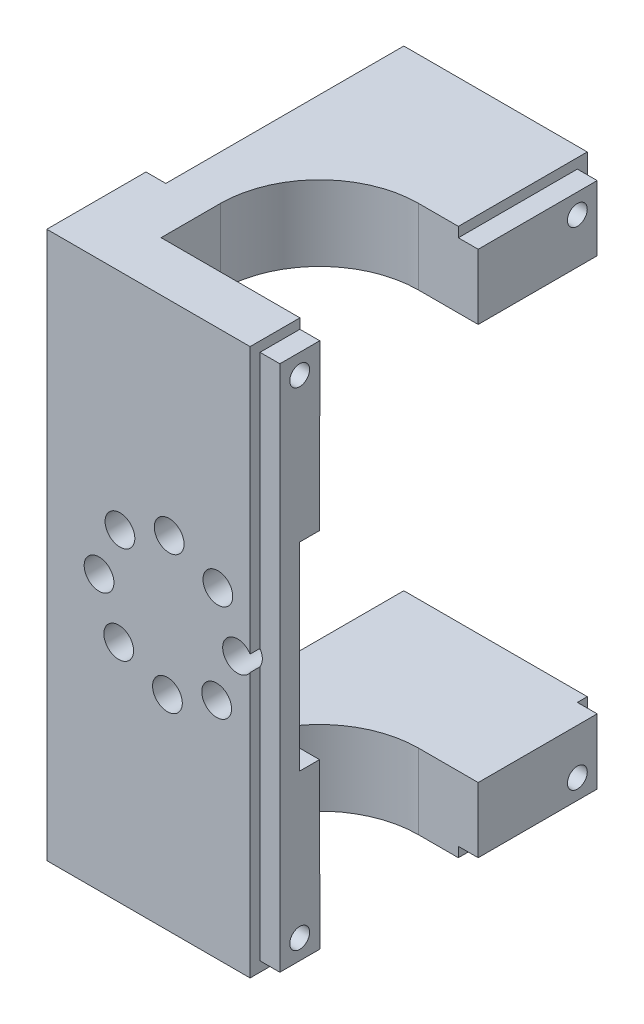
from build123d import *

# Parameters (mm, degrees)
SKETCH_1_W           = 20.5
SKETCH_1_H           = 15.141704846
SKETCH_1_R           = 2
EXTRUDE_1_DEPTH      = 29
EXTRUDE_1_2_DEPTH    = 29
SKETCH_2_W           = 20.5
SKETCH_2_H           = 70.283409692
EXTRUDE_2_DEPTH      = 3
SKETCH_3_W           = 20.5
SKETCH_3_H           = 7.570852423
CUT_EXTRUDE_1_DEPTH  = 49.621002864
EXTRUDE_3_DEPTH      = 10
CUT_EXTRUDE_2_REACH  = 75.297
SKETCH_8_R           = 1.6
SKETCH_9_W           = 20.5
SKETCH_9_H           = 32
CUT_EXTRUDE_3_DEPTH  = 65.572982844
SKETCH_12_W          = 20.5
SKETCH_12_H          = 7.570852423
SKETCH_12_R          = 2
EXTRUDE_5_DEPTH      = 30
SKETCH_13_R          = 4
SKETCH_13_R_2        = 2.5
EXTRUDE_6_DEPTH      = 10
CUT_EXTRUDE_5_DEPTH  = 48.388093988
CUT_EXTRUDE_6_DEPTH  = 51.404676959
EXTRUDE_START        = 10
EXTRUDE_7_DEPTH      = 10
CUT_EXTRUDE_7_DEPTH  = 48.388094067
CUT_EXTRUDE_8_DEPTH  = 51.404676959
SKETCH_23_W          = 20.5
SKETCH_23_H          = 55.141704846
EXTRUDE_8_DEPTH      = 2
SKETCH_24_W          = 10
SKETCH_24_H          = 55.141704846
EXTRUDE_9_DEPTH      = 2
SKETCH_25_W          = 8
SKETCH_25_H          = 7.570852423
CUT_EXTRUDE_9_DEPTH  = 16
EXTRUDE_START_2      = 20
SKETCH_26_R          = 2
EXTRUDE_10_DEPTH     = 20
SKETCH_27_W          = 16
SKETCH_27_H          = 8
CUT_EXTRUDE_10_DEPTH = 75.494994619
SKETCH_29_W          = 34
SKETCH_29_H          = 55.141704846
SKETCH_29_W_2        = 32
SKETCH_29_H_2        = 53.141704846
CUT_EXTRUDE_11_DEPTH = 2
SKETCH_32_W          = 15.976862795
SKETCH_32_H          = 55.18580585
CUT_EXTRUDE_13_DEPTH = 16
SKETCH_33_R          = 1
CUT_EXTRUDE_14_DEPTH = 16
SKETCH_35_R          = 1
CUT_EXTRUDE_15_DEPTH = 5
SKETCH_36_R          = 2.65
CUT_EXTRUDE_16_DEPTH = 10
CUT_EXTRUDE_START    = -10
SKETCH_37_R          = 2.65
CUT_EXTRUDE_17_DEPTH = 10
SKETCH_38_W          = 122.701486855
SKETCH_38_H          = 146.920996025
SKETCH_38_W_2        = 22.5
SKETCH_38_H_2        = 55.141704846
CUT_EXTRUDE_18_DEPTH = 50.016644776
SKETCH_39_R          = 1.5
CUT_EXTRUDE_22_DEPTH = 5
SKETCH_41_W          = 20.5
SKETCH_41_H          = 20
CUT_EXTRUDE_23_DEPTH = 2
FILLET_1_R           = 10
FILLET_2_R           = 10


with BuildPart() as part:
    # 草图1 → 凸台-拉伸1 (new body)
    with BuildSketch(Plane.XY):
        with Locations((0, -27.570852423)):
            Rectangle(SKETCH_1_W, SKETCH_1_H)
        with Locations((-5, -25)):
            Circle(SKETCH_1_R, mode=Mode.SUBTRACT)
        with Locations((5, -25)):
            Circle(SKETCH_1_R, mode=Mode.SUBTRACT)
    extrude(amount=EXTRUDE_1_DEPTH)



with BuildPart() as body_2:
    # 草图1 → Extrude 1 2 (new body)
    with BuildSketch(Plane.XY):
        with Locations((0, 27.570852423)):
            Rectangle(SKETCH_1_W, SKETCH_1_H)
        with Locations((5, 25)):
            Circle(SKETCH_1_R, mode=Mode.SUBTRACT)
        with Locations((-5, 25)):
            Circle(SKETCH_1_R, mode=Mode.SUBTRACT)
    extrude(amount=EXTRUDE_1_2_DEPTH)


with BuildPart() as part_1:
    add(part.part)

    add(body_2.part)  # 凸台-拉伸2 merges body 2
    # 草图2 → 凸台-拉伸2 (add)
    with BuildSketch(Plane.XY.offset(29)):
        Rectangle(SKETCH_2_W, SKETCH_2_H)
    extrude(amount=EXTRUDE_2_DEPTH)

    # 草图3 → 切除-拉伸1 (cut, through all)
    with BuildSketch(Plane(origin=(0, 0, 0), x_dir=(-1, 0, 0), z_dir=(0, 0, -1))):
        with Locations((0, -31.356278635)):
            Rectangle(SKETCH_3_W, SKETCH_3_H)
        with Locations((0, 31.356278635)):
            Rectangle(SKETCH_3_W, SKETCH_3_H)
    extrude(amount=-CUT_EXTRUDE_1_DEPTH, mode=Mode.SUBTRACT)

    # 草图5 → 凸台-拉伸3 (add)
    with BuildSketch(Plane.XZ.offset(27.570852423)):
        with BuildLine():
            ThreePointArc((0, 0), (1.767766953, 0.732233047), (2.5, 2.5))
            ThreePointArc((2.5, 2.5), (-1.767766953, 4.267766953), (0, 0))
        make_face()
    extrude(amount=EXTRUDE_3_DEPTH)

    # 草图8 → 切除-拉伸2 (cut, up to next)
    with BuildSketch(Plane(origin=(0, 27.570852423, 0), x_dir=(1, 0, 0), z_dir=(0, 1, 0)), mode=Mode.PRIVATE) as cut_extrude_2_sk1:
        with Locations((0, -16.5)):
            Circle(SKETCH_8_R)
    cut_extrude_2_tool1 = extrude(cut_extrude_2_sk1.sketch, amount=-CUT_EXTRUDE_2_REACH, mode=Mode.PRIVATE) & part_1.part
    # 草图8 → 切除-拉伸2 (cut, up to next)
    with BuildSketch(Plane(origin=(0, 27.570852423, 0), x_dir=(1, 0, 0), z_dir=(0, 1, 0)), mode=Mode.PRIVATE) as cut_extrude_2_sk2:
        with Locations((0, -26.5)):
            Circle(SKETCH_8_R)
    cut_extrude_2_tool2 = extrude(cut_extrude_2_sk2.sketch, amount=-CUT_EXTRUDE_2_REACH, mode=Mode.PRIVATE) & part_1.part
    add(cut_extrude_2_tool1.solids().sort_by_distance((0, 27.570852, 16.5))[0], mode=Mode.SUBTRACT)
    add(cut_extrude_2_tool2.solids().sort_by_distance((0, 27.570852, 26.5))[0], mode=Mode.SUBTRACT)

    # 草图9 → 切除-拉伸3 (cut, through all)
    with BuildSketch(Plane.XZ.offset(27.570852423)):
        with Locations((0, 16)):
            Rectangle(SKETCH_9_W, SKETCH_9_H)
    extrude(amount=CUT_EXTRUDE_3_DEPTH, mode=Mode.SUBTRACT)

    # 草图12 → 凸台-拉伸5 (add)
    with BuildSketch(Plane(origin=(0, 0, 0), x_dir=(-1, 0, 0), z_dir=(0, 0, -1))):
        with Locations((0, 23.785426212)):
            Rectangle(SKETCH_12_W, SKETCH_12_H)
        with Locations((-5, 25)):
            Circle(SKETCH_12_R, mode=Mode.SUBTRACT)
        with Locations((5, 25)):
            Circle(SKETCH_12_R, mode=Mode.SUBTRACT)
    extrude(amount=-EXTRUDE_5_DEPTH)

    # 草图13 → 凸台-拉伸6 (add)
    with BuildSketch(Plane(origin=(0, 27.570852423, 0), x_dir=(1, 0, 0), z_dir=(0, 1, 0))):
        with Locations((0, -5)):
            Circle(SKETCH_13_R)
        with Locations((0, -5)):
            Circle(SKETCH_13_R_2, mode=Mode.SUBTRACT)
    extrude(amount=EXTRUDE_6_DEPTH)

    # 草图15 → 旋转1 (revolve)
    with BuildSketch(Plane(origin=(0, 0, 0), x_dir=(0, 0, -1), z_dir=(1, 0, 0))):
        with BuildLine():
            Line((-1, 27.570852423), (0, 27.570852423))
            ThreePointArc((0, 27.570852423), (-0.712891912, 27.930797461), (-1, 28.676011695))
            Line((-1, 28.676011695), (-1, 27.570852423))
        make_face()
    revolve(axis=Axis((0, -962.429147577, 5), (0, 1, 0)))

    # 草图16 → 切除-拉伸5 (cut, through all)
    with BuildSketch(Plane.XY.offset(5)):
        with BuildLine():
            ThreePointArc((0, 35.070852423), (-1.060660172, 32.510192251), (1.5, 33.570852423))
            ThreePointArc((1.5, 33.570852423), (1.060660172, 34.631512595), (0, 35.070852423))
        make_face()
    extrude(amount=-CUT_EXTRUDE_5_DEPTH, mode=Mode.SUBTRACT)

    # 草图17 → 切除-拉伸6 (cut, through all)
    with BuildSketch(Plane(origin=(0, 0, 0), x_dir=(0, 0, -1), z_dir=(1, 0, 0))):
        with BuildLine():
            ThreePointArc((-5, 35.070852423), (-6.060660172, 32.510192251), (-3.5, 33.570852423))
            ThreePointArc((-3.5, 33.570852423), (-3.939339828, 34.631512595), (-5, 35.070852423))
        make_face()
    extrude(amount=-CUT_EXTRUDE_6_DEPTH, mode=Mode.SUBTRACT)

    # 草图19 → 凸台-拉伸7 (add)
    with BuildSketch(Plane.XZ.offset(27.570852423).offset(EXTRUDE_START)):
        with BuildLine():
            ThreePointArc((4, 5), (-2.828427125, 7.828427125), (0, 1))
            ThreePointArc((0, 1), (2.828427125, 2.171572875), (4, 5))
        make_face()
        with BuildLine():
            ThreePointArc((2.5, 5), (1.767766953, 3.232233047), (0, 2.5))
            ThreePointArc((0, 2.5), (-1.767766953, 6.767766953), (2.5, 5))
        make_face(mode=Mode.SUBTRACT)
    extrude(amount=-EXTRUDE_7_DEPTH)

    # 草图20 → 旋转2 (revolve)
    with BuildSketch(Plane(origin=(0, 0, 0), x_dir=(0, 0, -1), z_dir=(1, 0, 0))):
        with BuildLine():
            Line((-1, -27.570852423), (0, -27.570852423))
            ThreePointArc((0, -27.570852423), (-0.707106781, -27.863745642), (-1, -28.570852423))
            Line((-1, -28.570852423), (-1, -27.570852423))
        make_face()
    revolve(axis=Axis((0, -1027.570852423, 5), (0, 1, 0)))

    # 草图21 → 切除-拉伸7 (cut, through all)
    with BuildSketch(Plane.XY.offset(5)):
        with BuildLine():
            ThreePointArc((0, -35.070852423), (1.060660172, -34.631512595), (1.5, -33.570852423))
            ThreePointArc((1.5, -33.570852423), (-1.060660172, -32.510192251), (0, -35.070852423))
        make_face()
    extrude(amount=-CUT_EXTRUDE_7_DEPTH, mode=Mode.SUBTRACT)

    # 草图22 → 切除-拉伸8 (cut, through all)
    with BuildSketch(Plane(origin=(0, 0, 0), x_dir=(0, 0, -1), z_dir=(1, 0, 0))):
        with BuildLine():
            ThreePointArc((-5, -35.070852423), (-3.939339828, -34.631512595), (-3.5, -33.570852423))
            ThreePointArc((-3.5, -33.570852423), (-6.060660172, -32.510192251), (-5, -35.070852423))
        make_face()
    extrude(amount=-CUT_EXTRUDE_8_DEPTH, mode=Mode.SUBTRACT)

    # 草图23 → 凸台-拉伸8 (add)
    with BuildSketch(Plane.XY.offset(32)):
        Rectangle(SKETCH_23_W, SKETCH_23_H)
    extrude(amount=EXTRUDE_8_DEPTH)

    # 草图24 → 凸台-拉伸9 (add)
    with BuildSketch(Plane.ZY.offset(10.25)):
        with Locations((29, 0)):
            Rectangle(SKETCH_24_W, SKETCH_24_H)
    extrude(amount=EXTRUDE_9_DEPTH)

    # 草图25 → 切除-拉伸9 (cut)
    with BuildSketch(Plane(origin=(10.25, 0, 0), x_dir=(0, 0, -1), z_dir=(1, 0, 0))):
        with Locations((-21, 23.785426212)):
            Rectangle(SKETCH_25_W, SKETCH_25_H)
        with Locations((-21, -23.785426212)):
            Rectangle(SKETCH_25_W, SKETCH_25_H)
    extrude(amount=-CUT_EXTRUDE_9_DEPTH, mode=Mode.SUBTRACT)

    # 草图26 → 凸台-拉伸10 (add)
    with BuildSketch(Plane(origin=(0, 0, 29), x_dir=(-1, 0, 0), z_dir=(0, 0, -1)).offset(EXTRUDE_START_2)):
        with Locations((-5, 25)):
            Circle(SKETCH_26_R)
        with Locations((5, 25)):
            Circle(SKETCH_26_R)
        with Locations((-5, -25)):
            Circle(SKETCH_26_R)
        with Locations((5, -25)):
            Circle(SKETCH_26_R)
    extrude(amount=-EXTRUDE_10_DEPTH)

    # 草图27 → 切除-拉伸10 (cut, through all)
    with BuildSketch(Plane.XZ.offset(27.570852423)):
        with Locations((2.25, 21)):
            Rectangle(SKETCH_27_W, SKETCH_27_H)
    extrude(amount=-CUT_EXTRUDE_10_DEPTH, mode=Mode.SUBTRACT)

    # 草图29 → 切除-拉伸11 (cut)
    with BuildSketch(Plane(origin=(10.25, 0, 0), x_dir=(0, 0, -1), z_dir=(1, 0, 0))):
        with Locations((-17, 0)):
            Rectangle(SKETCH_29_W, SKETCH_29_H)
        with Locations((-17, 0)):
            Rectangle(SKETCH_29_W_2, SKETCH_29_H_2, mode=Mode.SUBTRACT)
    extrude(amount=-CUT_EXTRUDE_11_DEPTH, mode=Mode.SUBTRACT)

    # 草图32 → 切除-拉伸13 (cut)
    with BuildSketch(Plane(origin=(10.25, 0, 0), x_dir=(0, 0, -1), z_dir=(1, 0, 0))):
        with Locations((-20.988431398, 0.000987062)):
            Rectangle(SKETCH_32_W, SKETCH_32_H)
    extrude(amount=-CUT_EXTRUDE_13_DEPTH, mode=Mode.SUBTRACT)

    # 草图33 → 切除-拉伸14 (cut)
    with BuildSketch(Plane(origin=(10.25, 0, 0), x_dir=(0, 0, -1), z_dir=(1, 0, 0))):
        with Locations((-31, 24.570852423)):
            Circle(SKETCH_33_R)
        with Locations((-31, -24.570852423)):
            Circle(SKETCH_33_R)
    extrude(amount=-CUT_EXTRUDE_14_DEPTH, mode=Mode.SUBTRACT)

    # 草图35 → 切除-拉伸15 (cut)
    with BuildSketch(Plane(origin=(10.25, 0, 0), x_dir=(0, 0, -1), z_dir=(1, 0, 0))):
        with Locations((-3, 24.570852423)):
            Circle(SKETCH_35_R)
        with Locations((-3, -24.570852423)):
            Circle(SKETCH_35_R)
    extrude(amount=-CUT_EXTRUDE_15_DEPTH, mode=Mode.SUBTRACT)

    # 草图36 → 切除-拉伸16 (cut)
    with BuildSketch(Plane.XZ.offset(37.570852423)):
        with Locations((0, 5)):
            Circle(SKETCH_36_R)
    extrude(amount=-CUT_EXTRUDE_16_DEPTH, mode=Mode.SUBTRACT)

    # 草图37 → 切除-拉伸17 (cut)
    with BuildSketch(Plane(origin=(0, 37.570852423, 0), x_dir=(1, 0, 0), z_dir=(0, 1, 0)).offset(CUT_EXTRUDE_START)):
        with Locations((0, -5)):
            Circle(SKETCH_37_R)
    extrude(amount=CUT_EXTRUDE_17_DEPTH, mode=Mode.SUBTRACT)

    # 草图38 → 切除-拉伸18 (cut, through all)
    with BuildSketch(Plane(origin=(0, 0, 29), x_dir=(-1, 0, 0), z_dir=(0, 0, -1))):
        with Locations((-6.386239306, 2.025016337)):
            Rectangle(SKETCH_38_W, SKETCH_38_H)
        with Locations((1, 0)):
            Rectangle(SKETCH_38_W_2, SKETCH_38_H_2, mode=Mode.SUBTRACT)
    extrude(amount=CUT_EXTRUDE_18_DEPTH, mode=Mode.SUBTRACT)

    # 草图39 → 切除-拉伸22 (cut)
    with BuildSketch(Plane(origin=(0, 0, 29), x_dir=(-1, 0, 0), z_dir=(0, 0, -1))):
        with Locations((-4.875977624, -5)):
            Circle(SKETCH_39_R)
        with Locations((5, -4.875977624)):
            Circle(SKETCH_39_R)
        with Locations((-5, 4.875977624)):
            Circle(SKETCH_39_R)
        with Locations((4.875977624, 5)):
            Circle(SKETCH_39_R)
        with Locations((-0.087697063, 6.983370749)):
            Circle(SKETCH_39_R)
        with Locations((6.983370749, 0.087697063)):
            Circle(SKETCH_39_R)
        with Locations((0.087697063, -6.983370749)):
            Circle(SKETCH_39_R)
        with Locations((-6.983370749, -0.087697063)):
            Circle(SKETCH_39_R)
    extrude(amount=-CUT_EXTRUDE_22_DEPTH, mode=Mode.SUBTRACT)

    # 草图41 → 切除-拉伸23 (cut)
    with BuildSketch(Plane(origin=(0, 0, 29), x_dir=(-1, 0, 0), z_dir=(0, 0, -1))):
        Rectangle(SKETCH_41_W, SKETCH_41_H)
    extrude(amount=-CUT_EXTRUDE_23_DEPTH, mode=Mode.SUBTRACT)

    # 圆角1
    fillet_1_edges = [part_1.edges().sort_by_distance(p)[0] for p in [
        (-5.75, 23.785426212, 13),
    ]]
    fillet(fillet_1_edges, radius=FILLET_1_R)

    # 圆角2
    fillet_2_edges = [part_1.edges().sort_by_distance(p)[0] for p in [
        (-5.75, -23.785426212, 13),
    ]]
    fillet(fillet_2_edges, radius=FILLET_2_R)


solid = part_1.part
